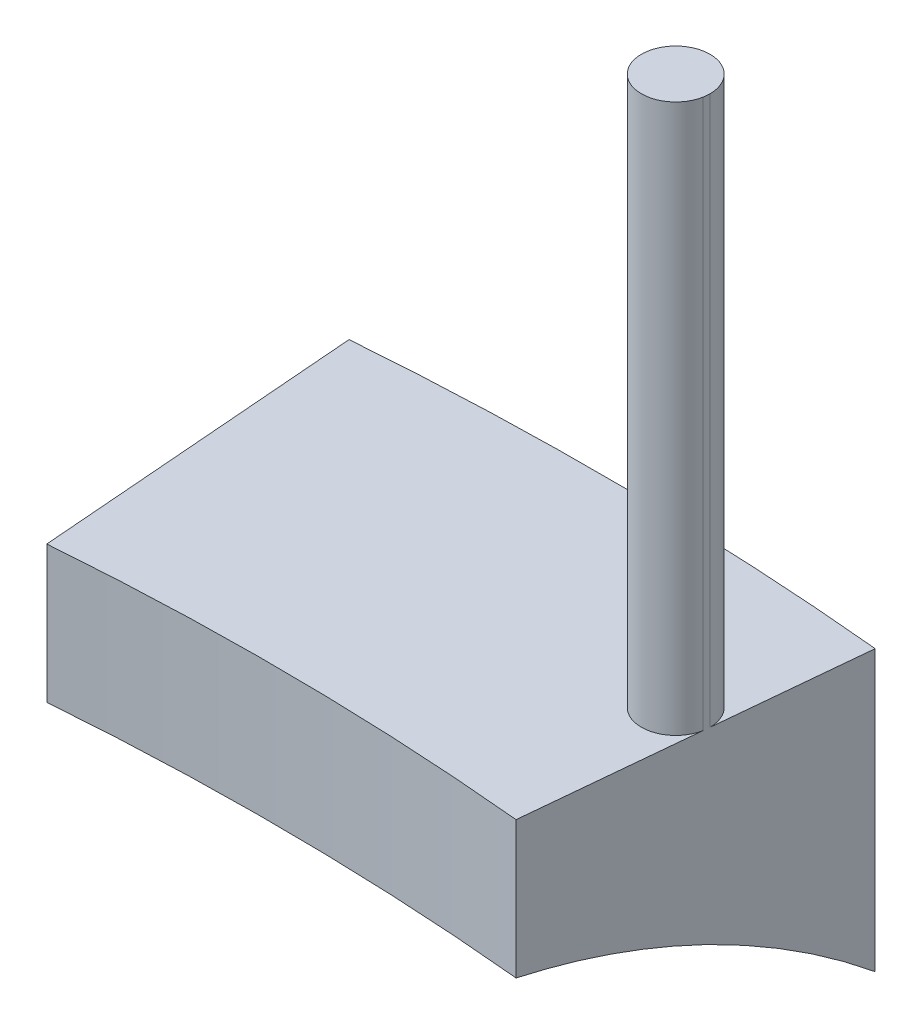
from build123d import *

# Parameters (mm, degrees)
SKETCH1_R           = 140.97
SKETCH1_R_2         = 125.73
BOSS_EXTRUDE1_DEPTH = 12.954
CUT_EXTRUDE1_START  = -12.954
CUT_EXTRUDE1_DEPTH  = 12.954
SKETCH5_R           = 1.5875
BOSS_EXTRUDE2_DEPTH = 38.354
SKETCH6_W           = 35.941656598
SKETCH6_H           = 50
CUT_EXTRUDE2_DEPTH  = 25.4


with BuildPart() as part:
    # Sketch1 → Boss-Extrude1 (new body)
    with BuildSketch(Plane(origin=(0, 0, 0), x_dir=(1, 0, 0), z_dir=(0, 1, 0))):
        Circle(SKETCH1_R)
        Circle(SKETCH1_R_2, mode=Mode.SUBTRACT)
    extrude(amount=BOSS_EXTRUDE1_DEPTH)

    # Sketch3 → Cut-Extrude1 (cut)
    with BuildSketch(Plane(origin=(0, 12.954, 0), x_dir=(1, 0, 0), z_dir=(0, 1, 0)).offset(CUT_EXTRUDE1_START)):
        with BuildLine():
            Line((0, 0), (-11.080200404, 140.53387513))
            ThreePointArc((-11.080200404, 140.53387513), (-1.210297371, -140.964804403), (13.491584054, 140.322906397))
            Line((13.491584054, 140.322906397), (0, 0))
        make_face()
    extrude(amount=CUT_EXTRUDE1_DEPTH, mode=Mode.SUBTRACT)

    # Sketch5 → Boss-Extrude2 (add)
    with BuildSketch(Plane(origin=(0, 0, 0), x_dir=(1, 0, 0), z_dir=(0, 1, 0))):
        with Locations((11.23230924, 133.345085246)):
            Circle(SKETCH5_R)
    extrude(amount=BOSS_EXTRUDE2_DEPTH)

    # Sketch2 → Cut-Revolve1 (revolve, cut)
    with BuildSketch(Plane.XY):
        with BuildLine():
            Line((-125.73, 6.604), (-125.73, 0))
            Line((-125.73, 0), (-140.97, 0))
            ThreePointArc((-140.97, 0), (-133.78949329, 4.316215284), (-125.73, 6.604))
        make_face()
    revolve(axis=Axis((0, 0, 0), (0, 1, 0)), mode=Mode.SUBTRACT)

    # Sketch6 → Cut-Extrude2 (cut)
    with BuildSketch(Plane(origin=(0, 0, 0), x_dir=(0.09570535612916914, 0, -0.9954097070092239), z_dir=(0.995409707009224, 0, 0.09570535612916914))):
        with Locations((132.91957607, 23.563430101)):
            Rectangle(SKETCH6_W, SKETCH6_H)
    extrude(amount=CUT_EXTRUDE2_DEPTH, mode=Mode.SUBTRACT)


solid = part.part
